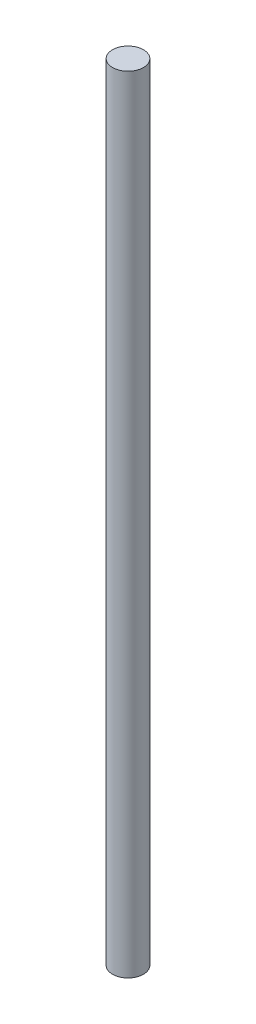
from build123d import *

# Parameters (mm, degrees)
SKETCH1_R           = 5
BOSS_EXTRUDE1_DEPTH = 254


with BuildPart() as part:
    # Sketch1 → Boss-Extrude1 (new body)
    with BuildSketch(Plane(origin=(0, 0, 0), x_dir=(1, 0, 0), z_dir=(0, 1, 0))):
        Circle(SKETCH1_R)
    extrude(amount=BOSS_EXTRUDE1_DEPTH)


solid = part.part
